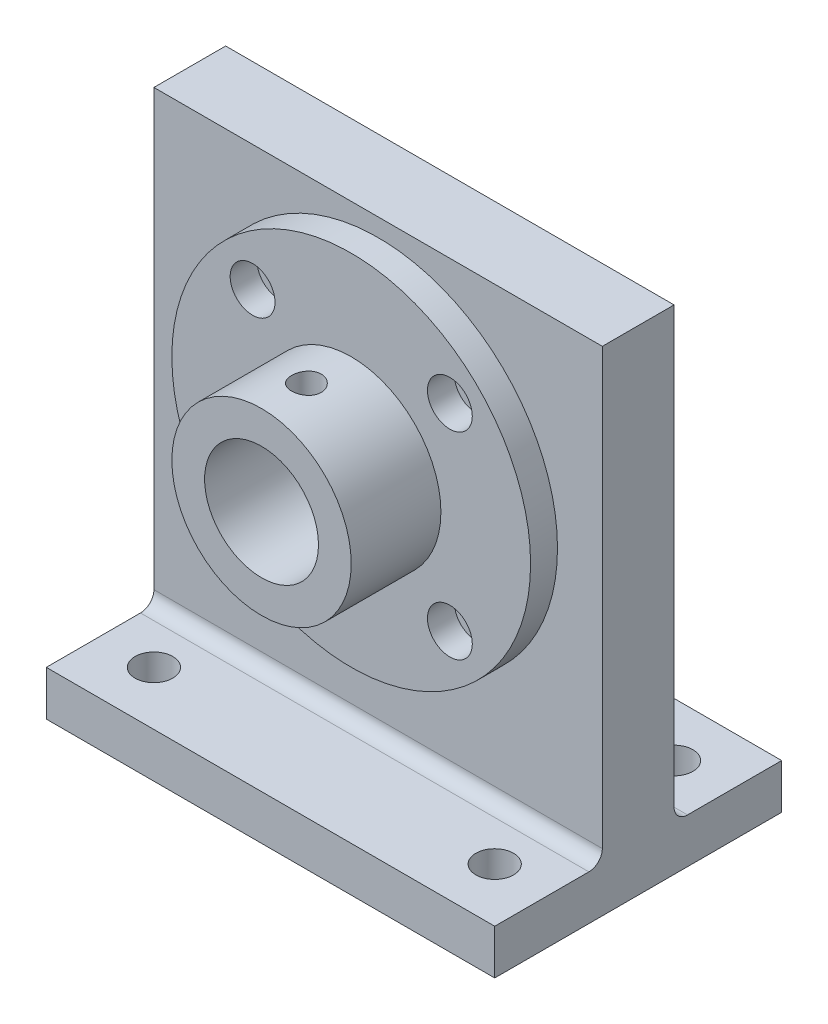
from build123d import *

# Parameters (mm, degrees)
B01_SLIP_PLATE_CIRPATTERN1_START         = 18.556607454
B01_SLIP_PLATE_CIRPATTERN1_OUTLINE_R     = 20
B01_SLIP_PLATE_CIRPATTERN1_OUTLINE_R_2   = 2.5
B01_SLIP_PLATE_CIRPATTERN1_OUTLINE_R_3   = 6.35
B01_SLIP_PLATE_CIRPATTERN1_DEPTH         = 3
B01_SLIP_PLATE_CIRPATTERN1_START_2       = 21.556607454
B01_SLIP_PLATE_CIRPATTERN1_2_OUTLINE_R   = 10
B01_SLIP_PLATE_CIRPATTERN1_2_OUTLINE_R_2 = 6.35
B01_SLIP_PLATE_CIRPATTERN1_2_DEPTH       = 3.350001044
B01_SLIP_PLATE_CIRPATTERN1_START_3       = 28.206607555
B01_SLIP_PLATE_CIRPATTERN1_3_OUTLINE_R   = 10
B01_SLIP_PLATE_CIRPATTERN1_3_OUTLINE_R_2 = 6.35
B01_SLIP_PLATE_CIRPATTERN1_3_DEPTH       = 3.349999899
B01_SLIP_PLATE_CIRPATTERN1_START_4       = 24.906608498
B01_SLIP_PLATE_CIRPATTERN1_4_OUTLINE_R   = 10
B01_SLIP_PLATE_CIRPATTERN1_4_OUTLINE_R_2 = 6.35
B01_SLIP_PLATE_CIRPATTERN1_4_DEPTH       = 3.299999057
B01_SLIP_PLATE_CIRPATTERN1_START_5       = 15
B01_SLIP_PLATE_CIRPATTERN1_5_OUTLINE_R   = 1.65
B01_SLIP_PLATE_CIRPATTERN1_5_DEPTH       = 6
SKETCH5_W                                = 50
SKETCH5_H                                = 50
BOSS_EXTRUDE1_DEPTH                      = 8
SKETCH6_W                                = 1.65
SKETCH6_H                                = 8
M4_TAPPED_HOLE1_AT_2_COUNT               = 2
M4_TAPPED_HOLE1_AT_2_PITCH               = 22
M4_TAPPED_HOLE1_AT_3_COUNT               = 2
M4_TAPPED_HOLE1_AT_3_PITCH               = 31.112698372
M4_TAPPED_HOLE1_AT_4_COUNT               = 2
M4_TAPPED_HOLE1_AT_4_PITCH               = 22
SKETCH8_W                                = 50
SKETCH8_H                                = 16
BOSS_EXTRUDE2_DEPTH                      = 5
SKETCH10_W                               = 2.1
SKETCH10_H                               = 5.001
MIRROR2_COPY_1_SKETCH_W                  = 2.1
MIRROR2_COPY_1_SKETCH_H                  = 5.001
SKETCH11_R                               = 7.35
CUT_EXTRUDE1_DEPTH                       = 46.97825573
FILLET1_R                                = 1.5


with BuildPart() as part:
    # <B01_slip_plate>-<CirPattern1>: read off the stored shape, not the designer's step
    # <B01_slip_plate>-<CirPattern1> outline → <B01_slip_plate>-<CirPattern1> (new body)
    with BuildSketch(Plane.XY.offset(B01_SLIP_PLATE_CIRPATTERN1_START)):
        with Locations((-47.612606287, 9.667439862)):
            Circle(B01_SLIP_PLATE_CIRPATTERN1_OUTLINE_R)
        with Locations((-58.612606287, -1.332560138)):
            Circle(B01_SLIP_PLATE_CIRPATTERN1_OUTLINE_R_2, mode=Mode.SUBTRACT)
        with Locations((-36.612606287, -1.332560138)):
            Circle(B01_SLIP_PLATE_CIRPATTERN1_OUTLINE_R_2, mode=Mode.SUBTRACT)
        with Locations((-58.612606287, 20.667439862)):
            Circle(B01_SLIP_PLATE_CIRPATTERN1_OUTLINE_R_2, mode=Mode.SUBTRACT)
        with Locations((-36.612606287, 20.667439862)):
            Circle(B01_SLIP_PLATE_CIRPATTERN1_OUTLINE_R_2, mode=Mode.SUBTRACT)
        with Locations((-47.612606287, 9.667439862)):
            Circle(B01_SLIP_PLATE_CIRPATTERN1_OUTLINE_R_3, mode=Mode.SUBTRACT)
    extrude(amount=B01_SLIP_PLATE_CIRPATTERN1_DEPTH)

    # B01_slip_plate_-_CirPattern1 2 outline → B01_slip_plate_-_CirPattern1 2 (add)
    with BuildSketch(Plane.XY.offset(B01_SLIP_PLATE_CIRPATTERN1_START_2)):
        with Locations((-47.612606287, 9.667439862)):
            Circle(B01_SLIP_PLATE_CIRPATTERN1_2_OUTLINE_R)
        with Locations((-47.612606287, 9.667439862)):
            Circle(B01_SLIP_PLATE_CIRPATTERN1_2_OUTLINE_R_2, mode=Mode.SUBTRACT)
    extrude(amount=B01_SLIP_PLATE_CIRPATTERN1_2_DEPTH)



with BuildPart() as body_2:
    # B01_slip_plate_-_CirPattern1 3 outline → B01_slip_plate_-_CirPattern1 3 (new body)
    with BuildSketch(Plane.XY.offset(B01_SLIP_PLATE_CIRPATTERN1_START_3)):
        with Locations((-47.612606287, 9.667439862)):
            Circle(B01_SLIP_PLATE_CIRPATTERN1_3_OUTLINE_R)
        with Locations((-47.612606287, 9.667439862)):
            Circle(B01_SLIP_PLATE_CIRPATTERN1_3_OUTLINE_R_2, mode=Mode.SUBTRACT)
    extrude(amount=B01_SLIP_PLATE_CIRPATTERN1_3_DEPTH)


with BuildPart() as part_1:
    add(part.part)

    add(body_2.part)  # B01_slip_plate_-_CirPattern1 4 merges body 2
    # B01_slip_plate_-_CirPattern1 4 outline → B01_slip_plate_-_CirPattern1 4 (add)
    with BuildSketch(Plane.XY.offset(B01_SLIP_PLATE_CIRPATTERN1_START_4)):
        with Locations((-47.612606287, 9.667439862)):
            Circle(B01_SLIP_PLATE_CIRPATTERN1_4_OUTLINE_R)
        with Locations((-47.612606287, 9.667439862)):
            Circle(B01_SLIP_PLATE_CIRPATTERN1_4_OUTLINE_R_2, mode=Mode.SUBTRACT)
    extrude(amount=B01_SLIP_PLATE_CIRPATTERN1_4_DEPTH)

    # B01_slip_plate_-_CirPattern1 5 outline → B01_slip_plate_-_CirPattern1 5 (cut)
    with BuildSketch(Plane(origin=(0, 0, 0), x_dir=(1, 0, 0), z_dir=(0, 1, 0)).offset(B01_SLIP_PLATE_CIRPATTERN1_START_5)):
        with Locations((-47.612606287, -26.556607454)):
            Circle(B01_SLIP_PLATE_CIRPATTERN1_5_OUTLINE_R)
    extrude(amount=B01_SLIP_PLATE_CIRPATTERN1_5_DEPTH, mode=Mode.SUBTRACT)


with BuildPart() as part_2:
    # B01_slip_plate: read off the stored shape, not the designer's step
    # B01_slip_plate: moved
    add(part_1.part.moved(Location((47.6126063, -9.6674399, -18.5566075))))


with BuildPart() as body_2_2:
    # Sketch5 → Boss-Extrude1 (new body)
    with BuildSketch(Plane(origin=(0, 0, 0), x_dir=(-1, 0, 0), z_dir=(0, 0, -1))):
        with Locations((0, -3)):
            Rectangle(SKETCH5_W, SKETCH5_H)
    extrude(amount=BOSS_EXTRUDE1_DEPTH)

    # Sketch6 → M4 Tapped Hole1 (revolve, cut)
    with BuildSketch(Plane(origin=(-11, 11, 0), x_dir=(0, -1, 0), z_dir=(1, 0, 0))):
        with Locations((0.825, 4)):
            Rectangle(SKETCH6_W, SKETCH6_H)
    m4_tapped_hole1 = revolve(axis=Axis((-11, 11, 6.35), (0, 0, -1)), mode=Mode.SUBTRACT)

    # M4 Tapped Hole1 at 2: M4 Tapped Hole1 ×2
    with Locations(*[(i * M4_TAPPED_HOLE1_AT_2_PITCH, 0, 0) for i in range(1, M4_TAPPED_HOLE1_AT_2_COUNT)]):
        add(m4_tapped_hole1, mode=Mode.SUBTRACT)

    # M4 Tapped Hole1 at 3: M4 Tapped Hole1 ×2
    with Locations(*[Vector(0.7071067811865439, -0.7071067811865512, 0) * (i * M4_TAPPED_HOLE1_AT_3_PITCH) for i in range(1, M4_TAPPED_HOLE1_AT_3_COUNT)]):
        add(m4_tapped_hole1, mode=Mode.SUBTRACT)

    # M4 Tapped Hole1 at 4: M4 Tapped Hole1 ×2
    with Locations(*[(0, -i * M4_TAPPED_HOLE1_AT_4_PITCH, 0) for i in range(1, M4_TAPPED_HOLE1_AT_4_COUNT)]):
        add(m4_tapped_hole1, mode=Mode.SUBTRACT)

    # Sketch8 → Boss-Extrude2 (add)
    with BuildSketch(Plane.XZ.offset(28)):
        with Locations((0, -12)):
            Rectangle(SKETCH8_W, SKETCH8_H)
    boss_extrude2 = extrude(amount=BOSS_EXTRUDE2_DEPTH)

    # Sketch10 → Ø4.2 (4.2) Diameter Hole1 (revolve, cut)
    with BuildSketch(Plane(origin=(-19, -28, -14), x_dir=(0, 0, 1), z_dir=(1, 0, 0))):
        with Locations((1.05, 2.5005)):
            Rectangle(SKETCH10_W, SKETCH10_H)
    f_4_2_4_2_diameter_hole1 = revolve(axis=Axis((-19, -21.65, -14), (0, -1, 0)), mode=Mode.SUBTRACT)

    # Mirror1: Ø4.2 (4.2) Diameter Hole1 across plane
    add(f_4_2_4_2_diameter_hole1.mirror(Plane(origin=(0, 0, 0), x_dir=(0, 0, 1), z_dir=(1, 0, 0))), mode=Mode.SUBTRACT)

    # Mirror2: Boss-Extrude2, Ø4.2 (4.2) Diameter Hole1 across plane
    add(boss_extrude2.mirror(Plane.XY.offset(-4)))
    add(f_4_2_4_2_diameter_hole1.mirror(Plane.XY.offset(-4)), mode=Mode.SUBTRACT)

    # Mirror2 copy 1 sketch → Mirror2 copy 1 (revolve, cut)
    with BuildSketch(Plane(origin=(19, -28, 6), x_dir=(0, 0, -1), z_dir=(-1, 0, 0))):
        with Locations((1.05, 2.5005)):
            Rectangle(MIRROR2_COPY_1_SKETCH_W, MIRROR2_COPY_1_SKETCH_H)
    revolve(axis=Axis((19, -21.65, 6), (0, -1, 0)), mode=Mode.SUBTRACT)

    # Sketch11 → Cut-Extrude1 (cut, through all)
    with BuildSketch(Plane.XY):
        Circle(SKETCH11_R)
    extrude(amount=-CUT_EXTRUDE1_DEPTH, mode=Mode.SUBTRACT)

    # Fillet1
    fillet1_edges = [body_2_2.edges().sort_by_distance(p)[0] for p in [
        (0, -28, 0),
        (0, -28, -8),
    ]]
    fillet(fillet1_edges, radius=FILLET1_R)


solid = Compound([part_2.part, body_2_2.part])
